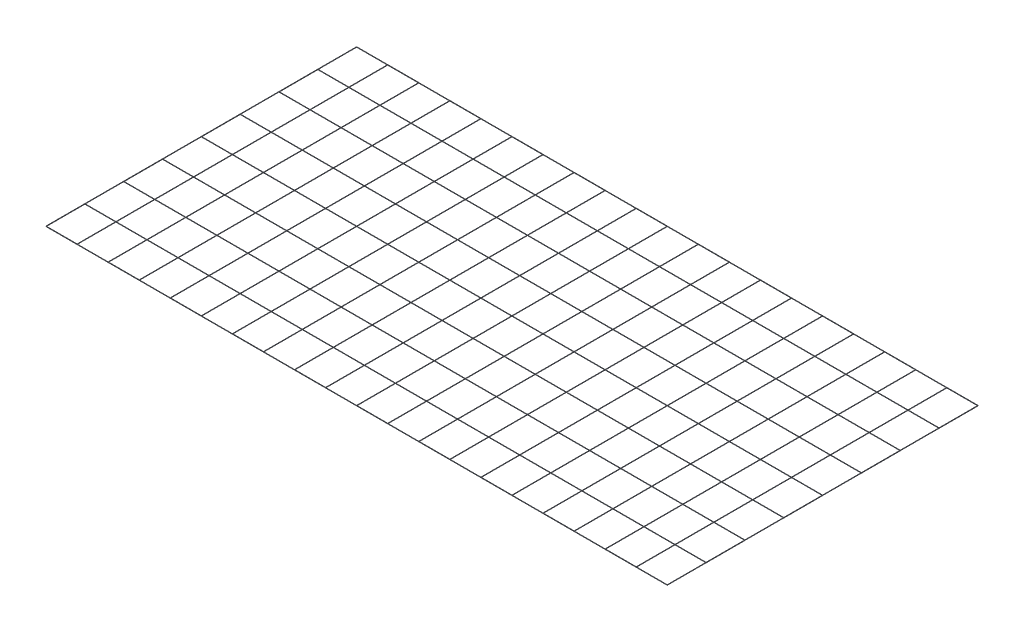
from build123d import *

# Parameters (mm, degrees)
BOSS_EXTRUDE1_DEPTH       = 0.1
SKETCH7_W                 = 0.1
SKETCH7_H                 = 0.1
BOSS_EXTRUDE16_DEPTH      = 0.05
BOSS_EXTRUDE3_DEPTH       = 0.1
LPATTERN3_COUNT           = 4
LPATTERN3_PITCH           = 0.2
BOSS_EXTRUDE5_OUTLINE_W   = 0.1
BOSS_EXTRUDE5_OUTLINE_H   = 0.1
BOSS_EXTRUDE5_DEPTH       = 0.05
BOSS_EXTRUDE5_2_OUTLINE_W = 0.1
BOSS_EXTRUDE5_2_OUTLINE_H = 0.1
BOSS_EXTRUDE5_2_DEPTH     = 0.05
BOSS_EXTRUDE5_3_OUTLINE_W = 0.1
BOSS_EXTRUDE5_3_OUTLINE_H = 0.1
BOSS_EXTRUDE5_3_DEPTH     = 0.05
BOSS_EXTRUDE5_4_OUTLINE_W = 0.1
BOSS_EXTRUDE5_4_OUTLINE_H = 0.1
BOSS_EXTRUDE5_4_DEPTH     = 0.05


# Read off the part's stored shape, not the designer's step: Boss-Extrude5
with BuildPart() as part:
    # Sketch1 → Boss-Extrude1 (new body)
    with BuildSketch(Plane(origin=(0, 0, 0), x_dir=(1, 0, 0), z_dir=(0, 1, 0))):
        Polygon((-500, 249.95), (499.95, 249.95), (499.95, 187.55), (-500.05, 187.55), (-500.05, 124.95), (499.95, 124.95), (499.95, 62.55), (-500.05, 62.55), (-500.05, -0.05), (499.95, -0.05), (499.95, -62.45), (-500.05, -62.45), (-500.05, -125.05), (499.95, -125.05), (499.95, -187.45), (-500.05, -187.45), (-500.05, -250.05), (500, -250.05), (500, -249.95), (-499.95, -249.95), (-499.95, -187.55), (500.05, -187.55), (500.05, -124.95), (-499.95, -124.95), (-499.95, -62.55), (500.05, -62.55), (500.05, 0.05), (-499.95, 0.05), (-499.95, 62.45), (500.05, 62.45), (500.05, 125.05), (-499.95, 125.05), (-499.95, 187.45), (500.05, 187.45), (500.05, 250.05), (-500, 250.05), align=None)
    extrude(amount=BOSS_EXTRUDE1_DEPTH)

    # Sketch7 → Boss-Extrude16 (add)
    with BuildSketch(Plane(origin=(500, 0, 0), x_dir=(0, 0, -1), z_dir=(1, 0, 0))):
        with Locations((-250, 0.05)):
            Rectangle(SKETCH7_W, SKETCH7_H)
    extrude(amount=BOSS_EXTRUDE16_DEPTH)


with BuildPart() as body_2:
    # Sketch2 → Boss-Extrude3 (new body)
    with BuildSketch(Plane(origin=(0, 0.1, 0), x_dir=(1, 0, 0), z_dir=(0, 1, 0))):
        Polygon((-500.05, 249.95), (-500.05, -250.05), (-449.95, -250.05), (-449.95, 249.95), (-400.05, 249.95), (-400.05, -250.05), (-349.95, -250.05), (-349.95, 249.95), (-300.05, 249.95), (-300.05, -250.05), (-249.95, -250.05), (-249.95, 249.95), (-200.05, 249.95), (-200.05, -250.05), (-149.95, -250.05), (-149.95, 249.95), (-100.05, 249.95), (-100.05, -250.05), (-49.95, -250.05), (-49.95, 249.95), (-0.05, 249.95), (-0.05, -250.05), (50.05, -250.05), (50.05, 249.95), (99.95, 249.95), (99.95, -250.05), (150.05, -250.05), (150.05, 249.95), (199.95, 249.95), (199.95, -250.05), (250.05, -250.05), (250.05, 249.95), (299.95, 249.95), (299.95, -250.05), (350.05, -250.05), (350.05, 249.95), (399.95, 249.95), (399.95, -250.05), (450.05, -250.05), (450.05, 249.95), (499.95, 249.95), (499.95, -250.05), (500.05, -250.05), (500.05, 250.05), (499.95, 250.05), (449.95, 250.05), (449.95, -249.95), (400.05, -249.95), (400.05, 249.95), (400.05, 250.05), (399.95, 250.05), (349.95, 250.05), (349.95, -249.95), (300.05, -249.95), (300.05, 249.95), (300.05, 250.05), (299.95, 250.05), (249.95, 250.05), (249.95, -249.95), (200.05, -249.95), (200.05, 249.95), (200.05, 250.05), (199.95, 250.05), (149.95, 250.05), (149.95, -249.95), (100.05, -249.95), (100.05, 249.95), (100.05, 250.05), (99.95, 250.05), (49.95, 250.05), (49.95, -249.95), (0.05, -249.95), (0.05, 249.95), (0.05, 250.05), (-0.05, 250.05), (-50.05, 250.05), (-50.05, -249.95), (-99.95, -249.95), (-99.95, 249.95), (-99.95, 250.05), (-100.05, 250.05), (-150.05, 250.05), (-150.05, -249.95), (-199.95, -249.95), (-199.95, 249.95), (-199.95, 250.05), (-200.05, 250.05), (-250.05, 250.05), (-250.05, -249.95), (-299.95, -249.95), (-299.95, 249.95), (-299.95, 250.05), (-300.05, 250.05), (-350.05, 250.05), (-350.05, -249.95), (-399.95, -249.95), (-399.95, 249.95), (-399.95, 250.05), (-400.05, 250.05), (-450.05, 250.05), (-450.05, -249.95), (-499.95, -249.95), (-499.95, 249.95), align=None)
    extrude(amount=BOSS_EXTRUDE3_DEPTH)


with BuildPart() as lpattern3_1:
    # LPattern3: pattern copy
    add(body_2.part.moved(Location(Vector(0, 1, 0) * (1 * LPATTERN3_PITCH))))


with BuildPart() as lpattern3_2:
    # LPattern3: pattern copy
    add(body_2.part.moved(Location(Vector(0, 1, 0) * (2 * LPATTERN3_PITCH))))


with BuildPart() as lpattern3_3:
    # LPattern3: pattern copy
    add(body_2.part.moved(Location(Vector(0, 1, 0) * (3 * LPATTERN3_PITCH))))


with BuildPart() as lpattern3_4:
    # LPattern3: pattern copy
    add(part.part.moved(Location(Vector(0, 1, 0) * (1 * LPATTERN3_PITCH))))

    # Boss-Extrude5 3 outline → Boss-Extrude5 3 (add)
    with BuildSketch(Plane.ZY.offset(500)):
        with Locations((-250, 0.25)):
            Rectangle(BOSS_EXTRUDE5_3_OUTLINE_W, BOSS_EXTRUDE5_3_OUTLINE_H)
    extrude(amount=BOSS_EXTRUDE5_3_DEPTH)


with BuildPart() as lpattern3_5:
    # LPattern3: pattern copy
    add(part.part.moved(Location(Vector(0, 1, 0) * (2 * LPATTERN3_PITCH))))

    # Boss-Extrude5 2 outline → Boss-Extrude5 2 (add)
    with BuildSketch(Plane.ZY.offset(500)):
        with Locations((-250, 0.45)):
            Rectangle(BOSS_EXTRUDE5_2_OUTLINE_W, BOSS_EXTRUDE5_2_OUTLINE_H)
    extrude(amount=BOSS_EXTRUDE5_2_DEPTH)


with BuildPart() as lpattern3_6:
    # LPattern3: pattern copy
    add(part.part.moved(Location(Vector(0, 1, 0) * (3 * LPATTERN3_PITCH))))

    # Boss-Extrude5 outline → Boss-Extrude5 (add)
    with BuildSketch(Plane.ZY.offset(500)):
        with Locations((-250, 0.65)):
            Rectangle(BOSS_EXTRUDE5_OUTLINE_W, BOSS_EXTRUDE5_OUTLINE_H)
    extrude(amount=BOSS_EXTRUDE5_DEPTH)


with BuildPart() as part_1:
    add(part.part)

    # Boss-Extrude5 4 outline → Boss-Extrude5 4 (add)
    with BuildSketch(Plane.ZY.offset(500)):
        with Locations((-250, 0.05)):
            Rectangle(BOSS_EXTRUDE5_4_OUTLINE_W, BOSS_EXTRUDE5_4_OUTLINE_H)
    extrude(amount=BOSS_EXTRUDE5_4_DEPTH)


solid = Compound([body_2.part, lpattern3_1.part, lpattern3_2.part, lpattern3_3.part, lpattern3_4.part, lpattern3_5.part, lpattern3_6.part, part_1.part])
